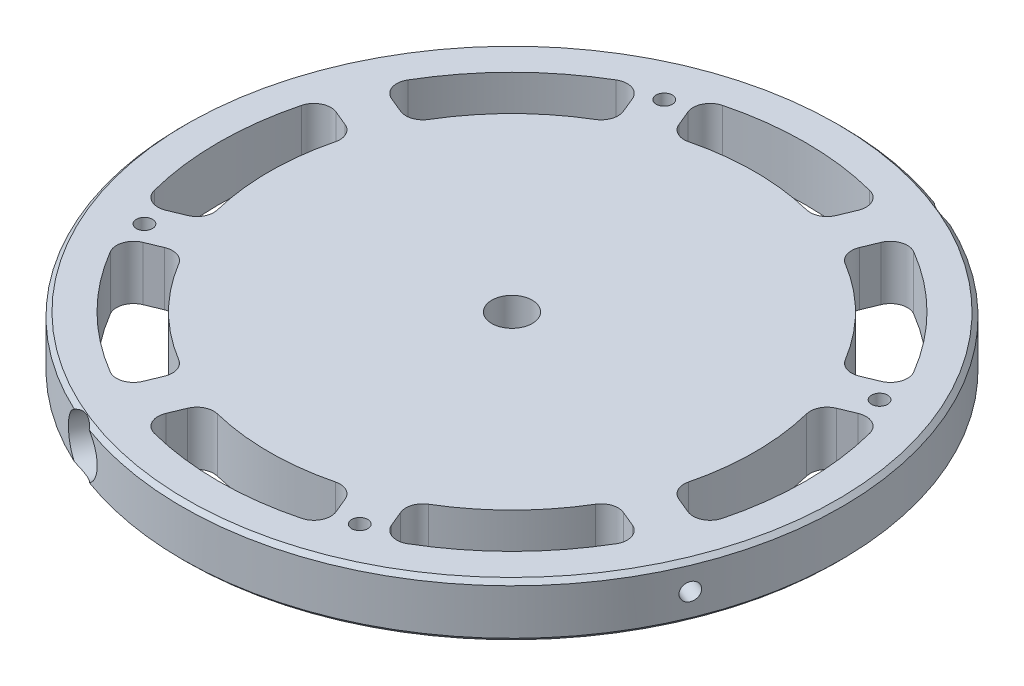
from build123d import *

# Parameters (mm, degrees)
SKETCH2_W                = 77.55
SKETCH2_H                = 12.7
F_10_24_TAPPED_HOLE2_D   = 3.7973
CIRPATTERN3_COUNT        = 4
CUT_EXTRUDE1_DEPTH       = 111.405140279
FILLET1_R                = 4
CIRPATTERN4_COUNT        = 8
FILLET1_OF_CIRPATTERN4_R = 4
CHAMFER1_SIZE            = 1
SKETCH15_W               = 2.0447
SKETCH15_H               = 101.323957926
SKETCH19_R               = 6.25
CUT_EXTRUDE3_DEPTH       = 5
CIRPATTERN5_COUNT        = 2
CIRPATTERN6_COUNT        = 2
SKETCH22_R               = 4.765
CUT_EXTRUDE4_DEPTH       = 12.8


with BuildPart() as part:
    # Sketch2 → Revolve1 (revolve)
    with BuildSketch(Plane(origin=(0, 0, 0), x_dir=(0, 0, -1), z_dir=(1, 0, 0))):
        with Locations((-38.775, 6.35)):
            Rectangle(SKETCH2_W, SKETCH2_H)
    revolve(axis=Axis((0, -0.888756804, 0), (0, 1, 0)))

    # #10-24 Tapped Hole2 (through all)
    with Locations(Plane(origin=(0, 12.7, 0), x_dir=(1, 0, 0), z_dir=(0, 1, 0))):
        with Locations((-25.333643223, 61.160825052)):
            f_10_24_tapped_hole2 = Hole(F_10_24_TAPPED_HOLE2_D / 2)

    # CirPattern3: #10-24 Tapped Hole2 ×4 about axis
    cirpattern3_axis = Axis((0, -0.888756804, 0), (0, 1, 0))
    for i in range(1, CIRPATTERN3_COUNT):
        add(f_10_24_tapped_hole2.rotate(cirpattern3_axis, i * 360 / CIRPATTERN3_COUNT), mode=Mode.SUBTRACT)

    # Sketch8 → Cut-Extrude1 (cut, through all)
    with BuildSketch(Plane(origin=(0, 12.7, 0), x_dir=(1, 0, 0), z_dir=(0, 1, 0))):
        with BuildLine():
            Line((-17.167098173, 54.510670885), (-21.735525784, 65.539830782))
            ThreePointArc((-21.735525784, 65.539830782), (0, 69.05), (21.735525784, 65.539830782))
            Line((21.735525784, 65.539830782), (17.167098173, 54.510670885))
            ThreePointArc((17.167098173, 54.510670885), (0, 57.15), (-17.167098173, 54.510670885))
        make_face()
    cut_extrude1 = extrude(amount=-CUT_EXTRUDE1_DEPTH, mode=Mode.SUBTRACT)

    # Fillet1
    fillet1_edges = [part.edges().sort_by_distance(p)[0] for p in [
        (17.167098173, 6.35, -54.510670885),
        (21.735525784, 6.35, -65.539830782),
        (-17.167098173, 6.35, -54.510670885),
        (-21.735525784, 6.35, -65.539830782),
    ]]
    fillet(fillet1_edges, radius=FILLET1_R)

    # CirPattern4: Cut-Extrude1 ×8 about axis
    cirpattern4_axis = Axis((0, -0.888756804, 0), (0, 1, 0))
    for i in range(1, CIRPATTERN4_COUNT):
        add(cut_extrude1.rotate(cirpattern4_axis, i * 360 / CIRPATTERN4_COUNT), mode=Mode.SUBTRACT)

    # Fillet1 of CirPattern4
    fillet1_of_cirpattern4_edges = [part.edges().sort_by_distance(p)[0] for p in [
        (-26.405893498, 6.35, -50.683836561),
        (-30.974321109, 6.35, -61.712996458),
        (-50.683836561, 6.35, -26.405893498),
        (-61.712996458, 6.35, -30.974321109),
        (-54.510670885, 6.35, -17.167098173),
        (-65.539830782, 6.35, -21.735525784),
        (-54.510670885, 6.35, 17.167098173),
        (-65.539830782, 6.35, 21.735525784),
        (-50.683836561, 6.35, 26.405893498),
        (-61.712996458, 6.35, 30.974321109),
        (-26.405893498, 6.35, 50.683836561),
        (-30.974321109, 6.35, 61.712996458),
        (-17.167098173, 6.35, 54.510670885),
        (-21.735525784, 6.35, 65.539830782),
        (17.167098173, 6.35, 54.510670885),
        (21.735525784, 6.35, 65.539830782),
        (26.405893498, 6.35, 50.683836561),
        (30.974321109, 6.35, 61.712996458),
        (50.683836561, 6.35, 26.405893498),
        (61.712996458, 6.35, 30.974321109),
        (54.510670885, 6.35, 17.167098173),
        (65.539830782, 6.35, 21.735525784),
        (54.510670885, 6.35, -17.167098173),
        (65.539830782, 6.35, -21.735525784),
        (50.683836561, 6.35, -26.405893498),
        (61.712996458, 6.35, -30.974321109),
        (26.405893498, 6.35, -50.683836561),
        (30.974321109, 6.35, -61.712996458),
    ]]
    fillet(fillet1_of_cirpattern4_edges, radius=FILLET1_OF_CIRPATTERN4_R)

    # Chamfer1
    chamfer1_edges = [part.edges().sort_by_distance(p)[0] for p in [
        (0, 0, -77.55),
        (0, 12.7, -77.55),
    ]]
    chamfer(chamfer1_edges, length=CHAMFER1_SIZE)

    # Sketch15 → #20 (0.161) Diameter Hole1 (revolve, cut)
    with BuildSketch(Plane(origin=(0, 6.35, 0), x_dir=(-0.38268343236508734, 0, 0.9238795325112877), z_dir=(0, 1, 0))):
        with Locations((1.02235, 50.661978963)):
            Rectangle(SKETCH15_W, SKETCH15_H)
    revolve(axis=Axis((-5.866635031, 6.35, -2.430039796), (0.9238795325112877, 0, 0.3826834323650874)), mode=Mode.SUBTRACT)

    # Sketch19 → Cut-Extrude3 (cut)
    with BuildSketch(Plane(origin=(29.67710018, 0, -71.646857746), x_dir=(-0.9238795325112891, 0, -0.38268343236508423), z_dir=(0.38268343236508423, 0, -0.9238795325112891))):
        with Locations((0, 6.35)):
            Circle(SKETCH19_R)
    cut_extrude3 = extrude(amount=-CUT_EXTRUDE3_DEPTH, mode=Mode.SUBTRACT)

    # CirPattern5: Cut-Extrude3 ×2 about axis
    cirpattern5_axis = Axis((0, -0.888756804, 0), (0, 1, 0))
    for i in range(1, CIRPATTERN5_COUNT):
        add(cut_extrude3.rotate(cirpattern5_axis, i * 360 / CIRPATTERN5_COUNT), mode=Mode.SUBTRACT)

    # Sketch21 → #10-24 Tapped Hole1 (revolve, cut)
    with BuildSketch(Plane(origin=(-27.763683018, 6.35, 67.027460084), x_dir=(0.9238795325112891, 0, 0.38268343236508423), z_dir=(0, 1, 0))):
        Polygon((0, 0), (0, 51.940824014), (1.89865, 50.8), (1.89865, 0), align=None)
    f_10_24_tapped_hole1 = revolve(axis=Axis((-30.193722814, 6.35, 72.894095115), (0.38268343236508423, 0, -0.923879532511289)), mode=Mode.SUBTRACT)

    # CirPattern6: #10-24 Tapped Hole1 ×2 about axis
    cirpattern6_axis = Axis((0, -0.888756804, 0), (0, 1, 0))
    for i in range(1, CIRPATTERN6_COUNT):
        add(f_10_24_tapped_hole1.rotate(cirpattern6_axis, i * 360 / CIRPATTERN6_COUNT), mode=Mode.SUBTRACT)

    # Sketch22 → Cut-Extrude4 (cut)
    with BuildSketch(Plane(origin=(0, 12.7, 0), x_dir=(1, 0, 0), z_dir=(0, 1, 0))):
        Circle(SKETCH22_R)
    extrude(amount=-CUT_EXTRUDE4_DEPTH, mode=Mode.SUBTRACT)


solid = part.part
